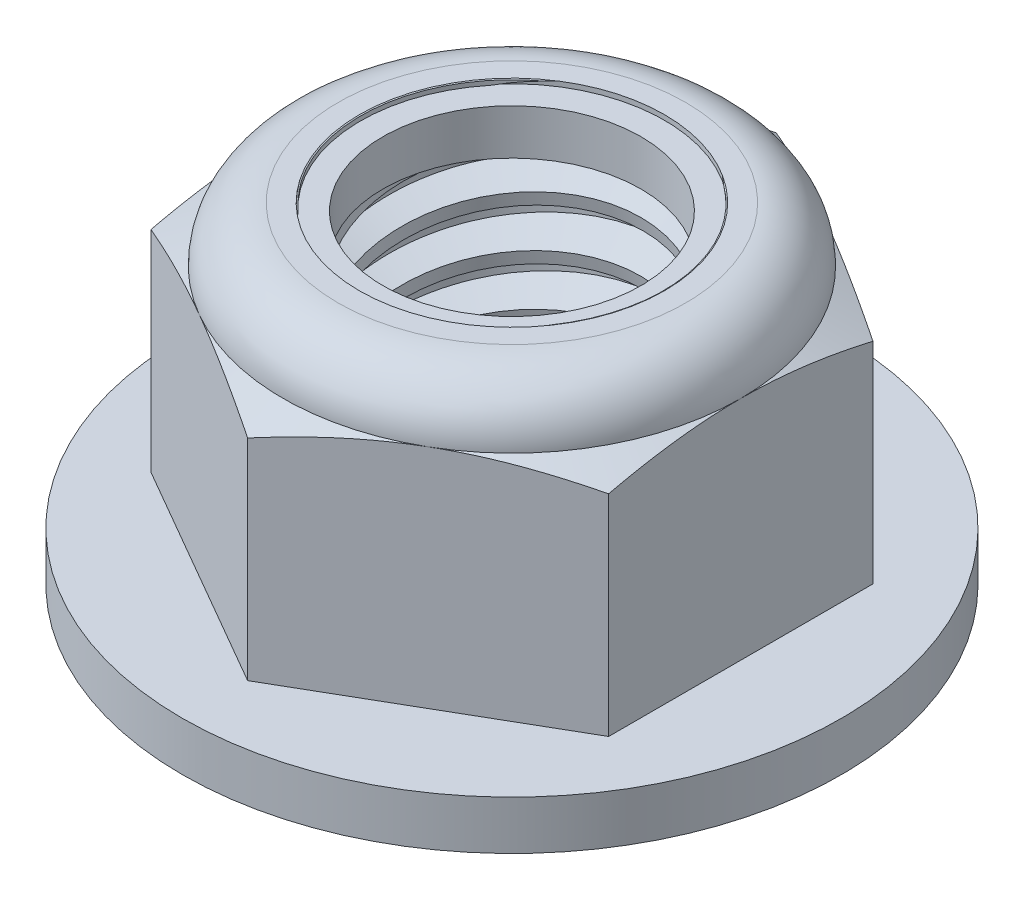
from build123d import *

# Parameters (mm, degrees)
EXTRUDE1_DEPTH       = 10.31875
SKETCH8_W            = 10.287
SKETCH8_H            = 1.524
SKETCH2_W            = 4.7625
SKETCH2_H            = 10.31875
LPATTERN1_COUNT      = 7
LPATTERN1_PITCH      = 1.5875
LPATTERN1_COUNT_DIR2 = 2
LPATTERN1_PITCH_DIR2 = 1.5875


with BuildPart() as part:
    # Sketch1 → Extrude1 (new body)
    with BuildSketch(Plane(origin=(0, 0, 0), x_dir=(1, 0, 0), z_dir=(0, 1, 0))):
        Polygon((0, 8.248891971), (-7.14375, 4.124445986), (-7.14375, -4.124445986), (0, -8.248891971), (7.14375, -4.124445986), (7.14375, 4.124445986), align=None)
    extrude(amount=EXTRUDE1_DEPTH)

    # Sketch8 → Revolve3 (revolve)
    with BuildSketch(Plane(origin=(0, 0, 0), x_dir=(0, 0, -1), z_dir=(1, 0, 0))):
        with Locations((5.1435, 0.762)):
            Rectangle(SKETCH8_W, SKETCH8_H)
    revolve(axis=Axis((0, 0, 0), (0, -1, 0)))

    # Sketch4 → Cut-Revolve2 (revolve, cut)
    with BuildSketch(Plane(origin=(0, 0, 0), x_dir=(0, 0, -1), z_dir=(1, 0, 0))):
        Polygon((0, 10.31875), (4.7625, 10.31875), (4.029111805, 9.976765468), (4.029111805, 0.341984532), (4.7625, 0), (0, 0), align=None)
    revolve(axis=Axis((0, 10.31875, 0), (0, 1, 0)), mode=Mode.SUBTRACT)


with BuildPart() as body_2:
    # Sketch2 → Revolve1 (revolve)
    with BuildSketch(Plane(origin=(0, 0, 0), x_dir=(0, 0, -1), z_dir=(1, 0, 0))):
        with Locations((2.38125, 5.159375)):
            Rectangle(SKETCH2_W, SKETCH2_H)
    revolve(axis=Axis((0, -4.7625, 0), (0, 1, 0)))

    # Sketch3 → Cut-Revolve1 (revolve, cut)
    with BuildSketch(Plane(origin=(0, 0, 0), x_dir=(0, 0, -1), z_dir=(1, 0, 0))):
        Polygon((4.795122924, 10.123012456), (5.023483392, 8.752849646), (4.094357653, 9.100932102), (4.029111805, 9.49240719), align=None)
    cut_revolve1 = revolve(axis=Axis((0, 10.31875, 0.28317269), (0, -0.9863939238321437, -0.16439898730535754)), mode=Mode.SUBTRACT)

    # LPattern1: Cut-Revolve1 7 × 2
    with Locations(*[Vector(0, -1, 0) * (i * LPATTERN1_PITCH) + Vector(0, 1, 0) * (j * LPATTERN1_PITCH_DIR2) for i in range(LPATTERN1_COUNT) for j in range(LPATTERN1_COUNT_DIR2) if (i, j) != (0, 0)]):
        add(cut_revolve1, mode=Mode.SUBTRACT)


with BuildPart() as part_1:
    add(part.part)

    # Combine1: cut body 2
    add(body_2.part, mode=Mode.SUBTRACT)

    # Sketch5 → Cut-Revolve3 (revolve, cut)
    with BuildSketch(Plane(origin=(0, 0, 0), x_dir=(0, 0, -1), z_dir=(1, 0, 0))):
        with BuildLine():
            Line((8.248891971, 1.524), (8.248891971, 8.083622169))
            Line((8.248891971, 8.083622169), (7.14375, 8.598958333))
            ThreePointArc((7.14375, 8.598958333), (6.640034683, 9.815034683), (5.423958333, 10.31875))
            Line((5.423958333, 10.31875), (5.423958333, 11.58875))
            Line((5.423958333, 11.58875), (9.518891971, 11.58875))
            Line((9.518891971, 11.58875), (9.518891971, 1.524))
            Line((9.518891971, 1.524), (8.248891971, 1.524))
        make_face()
    revolve(axis=Axis((0, 0, 0), (0, 1, 0)), mode=Mode.SUBTRACT)

    # Sketch6 → Cut-Revolve4 (revolve, cut)
    with BuildSketch(Plane(origin=(0, 0, 0), x_dir=(0, 0, -1), z_dir=(1, 0, 0))):
        with BuildLine():
            Line((0, 8.598958333), (6.99135, 8.598958333))
            ThreePointArc((6.99135, 8.598958333), (6.53227161, 9.70727161), (5.423958333, 10.16635))
            Line((5.423958333, 10.16635), (4.726535069, 10.16635))
            Line((4.726535069, 10.16635), (4.726535069, 11.58875))
            Line((4.726535069, 11.58875), (0, 11.58875))
            Line((0, 11.58875), (0, 8.598958333))
        make_face()
    revolve(axis=Axis((0, 11.58875, 0), (0, 1, 0)), mode=Mode.SUBTRACT)


with BuildPart() as body_2_2:
    # Sketch7 → Revolve2 (revolve)
    with BuildSketch(Plane(origin=(0, 0, 0), x_dir=(0, 0, -1), z_dir=(1, 0, 0))):
        with BuildLine():
            Line((4.029111805, 8.675158333), (6.913201815, 8.675158333))
            ThreePointArc((6.913201815, 8.675158333), (6.451096051, 9.679995195), (5.423958333, 10.09015))
            Line((5.423958333, 10.09015), (4.029111805, 10.09015))
            Line((4.029111805, 10.09015), (4.029111805, 8.675158333))
        make_face()
    revolve(axis=Axis((0, 8.675158333, 0), (0, 1, 0)))


solid = Compound([part_1.part, body_2_2.part])
